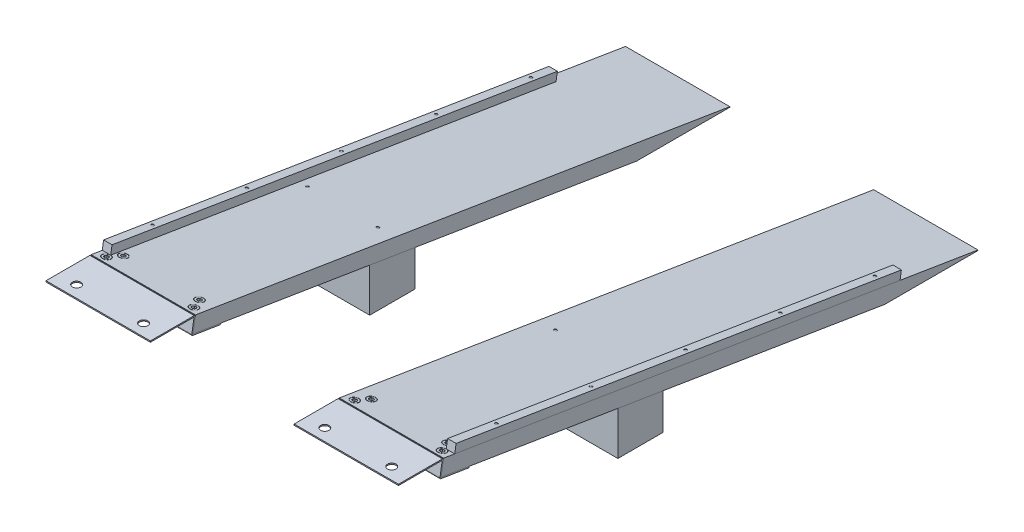
from build123d import *

# Parameters (mm, degrees)
BOSS_EXTRUDE1_DEPTH     = 117.475
BOSS_EXTRUDE2_DEPTH     = 117.475
BOSS_EXTRUDE3_DEPTH     = 117.475
FILLET1_R               = 2.54
FILLET2_R               = 1.27
BOSS_EXTRUDE4_DEPTH     = 19.05
SKETCH7_R               = 9.525
CUT_EXTRUDE1_DEPTH      = 1226.047332493
CUT_EXTRUDE2_DEPTH      = 1226.047332493
CUT_EXTRUDE2_DEPTH_BACK = 6.35
SKETCH8_R               = 9.525
SKETCH8_R_2             = 3.175
SKETCH9_R               = 8.89
BOSS_EXTRUDE5_DEPTH     = 6.35
BOSS_EXTRUDE5_DRAFT     = -30
CUT_EXTRUDE3_DEPTH      = 6.35


with BuildPart() as part:
    # Sketch3 → Boss-Extrude1 (new, symmetric)
    with BuildSketch(Plane(origin=(0, 0, 0), x_dir=(0, 0, -1), z_dir=(1, 0, 0))):
        Polygon((993.654193144, -196.85), (-5.59710983, -34.436240562), (0, 0), (1203.407939446, -195.596450063), (1203.204193144, -196.85), align=None)
    extrude(amount=BOSS_EXTRUDE1_DEPTH, both=True)


with BuildPart() as body_2:
    # Sketch4 → Boss-Extrude2 (new, symmetric)
    with BuildSketch(Plane(origin=(0, 0, 0), x_dir=(0, 0, -1), z_dir=(1, 0, 0))):
        Polygon((494.028541657, -196.85), (494.028541657, -115.643120281), (392.428541657, -99.129518638), (392.428541657, -196.85), align=None)
    extrude(amount=BOSS_EXTRUDE2_DEPTH, both=True)


with BuildPart() as body_3:
    # Sketch5 → Boss-Extrude3 (new, symmetric)
    with BuildSketch(Plane(origin=(0, 0, 0), x_dir=(0, 0, -1), z_dir=(1, 0, 0))):
        Polygon((0, 0), (-101.565255876, 0), (-101.565255876, -2.65684), (-3.123535816, -2.65684), (-8.645773562, -36.632429766), (56.654149752, -47.245982138), (57.080387016, -44.62355567), (-5.59710983, -34.436240562), align=None)
    extrude(amount=BOSS_EXTRUDE3_DEPTH, both=True)

    # Fillet1
    fillet1_edges = [body_3.edges().sort_by_distance(p)[0] for p in [
        (0, -36.632429766, 8.645773562),
        (0, 0, 0),
    ]]
    fillet(fillet1_edges, radius=FILLET1_R)

    # Fillet2
    fillet2_edges = [body_3.edges().sort_by_distance(p)[0] for p in [
        (0, -34.436240562, 5.59710983),
        (0, -2.65684, 3.123535816),
    ]]
    fillet(fillet2_edges, radius=FILLET2_R)

    # Sketch7 → Cut-Extrude1 (cut, through all)
    with BuildSketch(Plane(origin=(0, 0, 0), x_dir=(1, 0, 0), z_dir=(0, 1, 0))):
        with Locations(Location((-75.40625, -74.6125, 0), (0, 0, 270))):
            Circle(SKETCH7_R)
        with Locations(Location((75.40625, -74.6125, 0), (0, 0, 270))):
            Circle(SKETCH7_R)
    extrude(amount=-CUT_EXTRUDE1_DEPTH, mode=Mode.SUBTRACT)


with BuildPart() as body_4:
    # Sketch6 → Boss-Extrude4 (new body)
    with BuildSketch(Plane(origin=(117.475, 0, 0), x_dir=(0, 0, -1), z_dir=(1, 0, 0))):
        Polygon((1030.967142809, -148.268718708), (1027.910948277, -167.071967762), (25.070998738, -4.074926043), (28.127193271, 14.728323011), align=None)
    extrude(amount=-BOSS_EXTRUDE4_DEPTH)


with BuildPart() as cut_extrude2_tool:
    # Sketch8 → Cut-Extrude2 (new, two sides: drawn at the far end of the back side and taken through both)
    with BuildSketch(Plane(origin=(0, 0, 0), x_dir=(1, 0, 0), z_dir=(0, 0.987047194427853, -0.16043015917247105)).offset(-CUT_EXTRUDE2_DEPTH_BACK)):
        with Locations(Location((98.425, 15.875, 0), (0, 0, 90))):
            Circle(SKETCH8_R)
        with Locations(Location((85.725, 41.275, 0), (0, 0, 90))):
            Circle(SKETCH8_R)
        with Locations(Location((-85.725, 41.275, 0), (0, 0, 90))):
            Circle(SKETCH8_R)
        with Locations(Location((-98.425, 15.875, 0), (0, 0, 90))):
            Circle(SKETCH8_R)
        with Locations(Location((107.95, 990.6, 0), (0, 0, 90))):
            Circle(SKETCH8_R_2)
        with Locations(Location((107.95, 774.7, 0), (0, 0, 90))):
            Circle(SKETCH8_R_2)
        with Locations(Location((107.95, 558.8, 0), (0, 0, 90))):
            Circle(SKETCH8_R_2)
        with Locations(Location((107.95, 342.9, 0), (0, 0, 90))):
            Circle(SKETCH8_R_2)
        with Locations(Location((107.95, 127, 0), (0, 0, 90))):
            Circle(SKETCH8_R_2)
        with Locations(Location((-79.375, 454.715492857, 0), (0, 0, 90))):
            Circle(SKETCH8_R_2)
        with Locations(Location((79.375, 454.715492857, 0), (0, 0, 90))):
            Circle(SKETCH8_R_2)
    extrude(amount=CUT_EXTRUDE2_DEPTH + CUT_EXTRUDE2_DEPTH_BACK)


with BuildPart() as part_1:
    add(part.part)

    # Cut-Extrude2: cut by cut_extrude2_tool
    add(cut_extrude2_tool.part, mode=Mode.SUBTRACT)


with BuildPart() as body_4_1:
    add(body_4.part)

    # Cut-Extrude2: cut by cut_extrude2_tool
    add(cut_extrude2_tool.part, mode=Mode.SUBTRACT)


with BuildPart() as body_5:
    # Sketch9 → Boss-Extrude5 (with draft: the straight prism first)
    with BuildSketch(Plane(origin=(0, 0, 0), x_dir=(1, 0, 0), z_dir=(0, 0.987047194427853, -0.16043015917247105))):
        with Locations((98.425, 15.875)):
            Circle(SKETCH9_R)
    extrude(amount=-BOSS_EXTRUDE5_DEPTH)
    # Boss-Extrude5: the draft: its side faces are tilted about the plane it starts from
    boss_extrude5_sides = [body_5.faces().sort_by_distance(p)[0] for p in [
        (89.535, -5.680703619, -15.160008456),
    ]]
    draft(boss_extrude5_sides, Plane(origin=(0, 0, 0), x_dir=(1, 0, 0), z_dir=(0, 0.987047194427853, -0.16043015917247105)), BOSS_EXTRUDE5_DRAFT)

    # Sketch10 → Cut-Extrude3 (cut)
    with BuildSketch(Plane(origin=(0, 0, 0), x_dir=(1, 0, 0), z_dir=(0, 0.987047194427853, -0.16043015917247108))):
        Polygon((103.191026472, 15.875), (100.808013236, 20.0025), (96.041986764, 20.0025), (93.658973528, 15.875), (96.041986764, 11.7475), (100.808013236, 11.7475), align=None)
    extrude(amount=-CUT_EXTRUDE3_DEPTH, mode=Mode.SUBTRACT)

    # Cut-Extrude4 cone 1 section (through the dimple's axis) → Cut-Extrude4 (revolve, cut)
    with BuildSketch(Plane(origin=(98.425, -2.546828777, -15.669374212), x_dir=(0, 0.160430159, 0.987047194), z_dir=(1, 0, 0))):
        Polygon((0, 0), (4.766026472, 0), (0, 2.751666667), align=None)
    revolve(axis=Axis((98.425, -2.546828777, -15.669374212), (0, -0.987047194, 0.160430159)), mode=Mode.SUBTRACT)


with BuildPart() as body_6:
    # Sketch-Pattern1: read off the stored shape, not the designer's step
    # Sketch-Pattern1: copy of body 5
    add(body_5.part.moved(Location((-196.85, 0, 2e-07))))


with BuildPart() as body_7:
    # Sketch-Pattern1 2: copy of body 5
    add(body_5.part.moved(Location((-184.15, -4.074926, -25.0709985))))


with BuildPart() as body_8:
    # Sketch-Pattern1 3: copy of body 5
    add(body_5.part.moved(Location((-12.7, -4.074926, -25.0709985))))


with BuildPart() as body_9:
    # Boss-Extrude6 cone 1 section (through the dimple's axis) → Boss-Extrude6 (revolve)
    with BuildSketch(Plane(origin=(107.95, -2.19815613, -128.309315073), x_dir=(0, 0.160430159, 0.987047194), z_dir=(1, 0, 0))):
        Polygon((0, 0), (2.921, 0), (0, 5.059320409), align=None)
    revolve(axis=Axis((107.95, -2.19815613, -128.309315073), (0, -0.987047194, 0.160430159)))


with BuildPart() as body_10:
    # Sketch-Pattern3: read off the stored shape, not the designer's step
    # Sketch-Pattern3: copy of body 9
    add(body_9.part.moved(Location((0, -138.5474855, -852.4139571))))


with BuildPart() as body_11:
    # Sketch-Pattern3 2: copy of body 9
    add(body_9.part.moved(Location((0, -103.9106141, -639.3104678))))


with BuildPart() as body_12:
    # Sketch-Pattern3 3: copy of body 9
    add(body_9.part.moved(Location((0, -69.2737427, -426.2069786))))


with BuildPart() as body_13:
    # Sketch-Pattern3 4: copy of body 9
    add(body_9.part.moved(Location((0, -34.6368714, -213.1034893))))


with BuildPart() as body_14:
    # Boss-Extrude7 cone 1 section (through the dimple's axis) → Boss-Extrude7 (revolve)
    with BuildSketch(Plane(origin=(-79.375, -73.576853866, -448.723778336), x_dir=(0, 0.160430159, 0.987047194), z_dir=(1, 0, 0))):
        Polygon((0, 0), (2.921, 0), (0, 5.059320409), align=None)
    revolve(axis=Axis((-79.375, -73.576853866, -448.723778336), (0, -0.987047194, 0.160430159)))


with BuildPart() as body_15:
    # Mirror1: mirrored copy
    add(body_14.part.mirror(Plane(origin=(0, 0, 0), x_dir=(0, 0, 1), z_dir=(1, 0, 0))))


with BuildPart() as body_16:
    # Mirror2: mirrored copy
    add(body_2.part.mirror(Plane(origin=(-279.4, 0, 0), x_dir=(0, 0, 1), z_dir=(1, 0, 0))))


with BuildPart() as body_17:
    # Mirror2 2: mirrored copy
    add(body_3.part.mirror(Plane(origin=(-279.4, 0, 0), x_dir=(0, 0, 1), z_dir=(1, 0, 0))))


with BuildPart() as body_18:
    # Mirror2 3: mirrored copy
    add(part_1.part.mirror(Plane(origin=(-279.4, 0, 0), x_dir=(0, 0, 1), z_dir=(1, 0, 0))))


with BuildPart() as body_19:
    # Mirror2 4: mirrored copy
    add(body_4_1.part.mirror(Plane(origin=(-279.4, 0, 0), x_dir=(0, 0, 1), z_dir=(1, 0, 0))))


with BuildPart() as body_20:
    # Mirror2 5: mirrored copy
    add(body_5.part.mirror(Plane(origin=(-279.4, 0, 0), x_dir=(0, 0, 1), z_dir=(1, 0, 0))))


with BuildPart() as body_21:
    # Mirror2 6: mirrored copy
    add(body_8.part.mirror(Plane(origin=(-279.4, 0, 0), x_dir=(0, 0, 1), z_dir=(1, 0, 0))))


with BuildPart() as body_22:
    # Mirror2 7: mirrored copy
    add(body_7.part.mirror(Plane(origin=(-279.4, 0, 0), x_dir=(0, 0, 1), z_dir=(1, 0, 0))))


with BuildPart() as body_23:
    # Mirror2 8: mirrored copy
    add(body_6.part.mirror(Plane(origin=(-279.4, 0, 0), x_dir=(0, 0, 1), z_dir=(1, 0, 0))))


with BuildPart() as body_24:
    # Mirror2 9: mirrored copy
    add(body_9.part.mirror(Plane(origin=(-279.4, 0, 0), x_dir=(0, 0, 1), z_dir=(1, 0, 0))))


with BuildPart() as body_25:
    # Mirror2 10: mirrored copy
    add(body_13.part.mirror(Plane(origin=(-279.4, 0, 0), x_dir=(0, 0, 1), z_dir=(1, 0, 0))))


with BuildPart() as body_26:
    # Mirror2 11: mirrored copy
    add(body_12.part.mirror(Plane(origin=(-279.4, 0, 0), x_dir=(0, 0, 1), z_dir=(1, 0, 0))))


with BuildPart() as body_27:
    # Mirror2 12: mirrored copy
    add(body_11.part.mirror(Plane(origin=(-279.4, 0, 0), x_dir=(0, 0, 1), z_dir=(1, 0, 0))))


with BuildPart() as body_28:
    # Mirror2 13: mirrored copy
    add(body_10.part.mirror(Plane(origin=(-279.4, 0, 0), x_dir=(0, 0, 1), z_dir=(1, 0, 0))))


with BuildPart() as body_29:
    # Mirror2 14: mirrored copy
    add(body_14.part.mirror(Plane(origin=(-279.4, 0, 0), x_dir=(0, 0, 1), z_dir=(1, 0, 0))))


with BuildPart() as body_30:
    # Mirror2 15: mirrored copy
    add(body_15.part.mirror(Plane(origin=(-279.4, 0, 0), x_dir=(0, 0, 1), z_dir=(1, 0, 0))))


solid = Compound([body_2.part, body_3.part, part_1.part, body_4_1.part, body_5.part, body_6.part, body_7.part, body_8.part, body_9.part, body_10.part, body_11.part, body_12.part, body_13.part, body_14.part, body_15.part, body_16.part, body_17.part, body_18.part, body_19.part, body_20.part, body_21.part, body_22.part, body_23.part, body_24.part, body_25.part, body_26.part, body_27.part, body_28.part, body_29.part, body_30.part])
